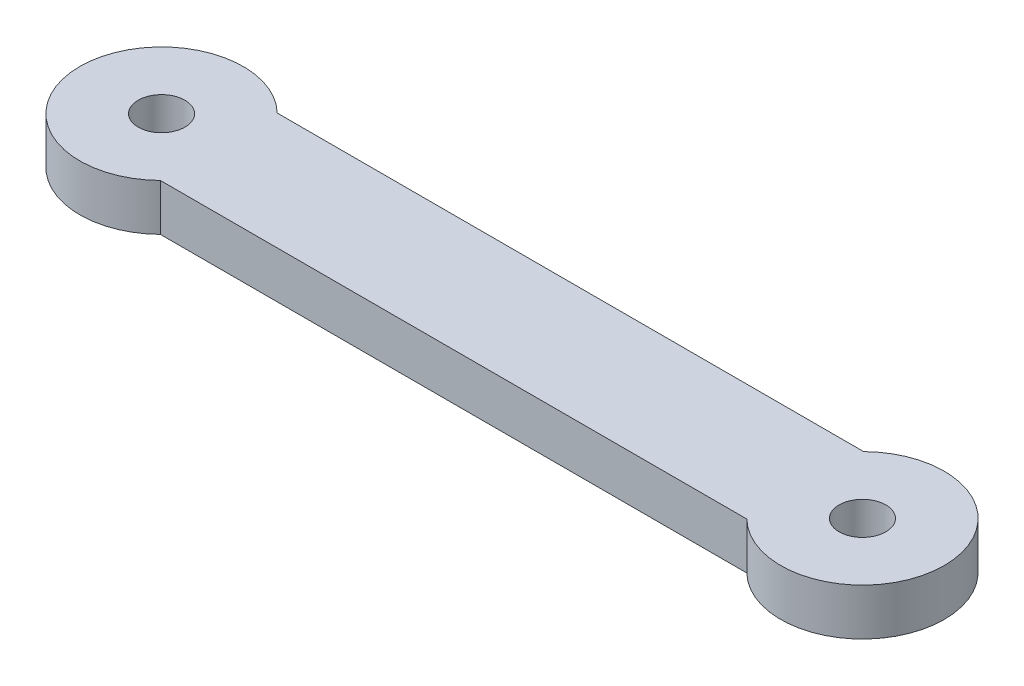
from build123d import *

# Parameters (mm, degrees)
CROQUIS2_R              = 1
SALIENTE_EXTRUIR1_DEPTH = 2


with BuildPart() as part:
    # Croquis2 → Saliente-Extruir1 (new body)
    with BuildSketch(Plane(origin=(0, 0, 0), x_dir=(1, 0, 0), z_dir=(0, 1, 0))):
        with BuildLine():
            Line((-13.360255821, 1.298148445), (11.740764693, 1.298148445))
            ThreePointArc((11.740764693, 1.298148445), (17.690254436, -1.201851555), (11.740764693, -3.701851555))
            Line((11.740764693, -3.701851555), (-13.360255821, -3.701851555))
            ThreePointArc((-13.360255821, -3.701851555), (-19.309745564, -1.201851555), (-13.360255821, 1.298148445))
        make_face()
        with Locations((-15.809745564, -1.201851555)):
            Circle(CROQUIS2_R, mode=Mode.SUBTRACT)
        with Locations((14.190254436, -1.201851555)):
            Circle(CROQUIS2_R, mode=Mode.SUBTRACT)
    extrude(amount=SALIENTE_EXTRUIR1_DEPTH)


solid = part.part
